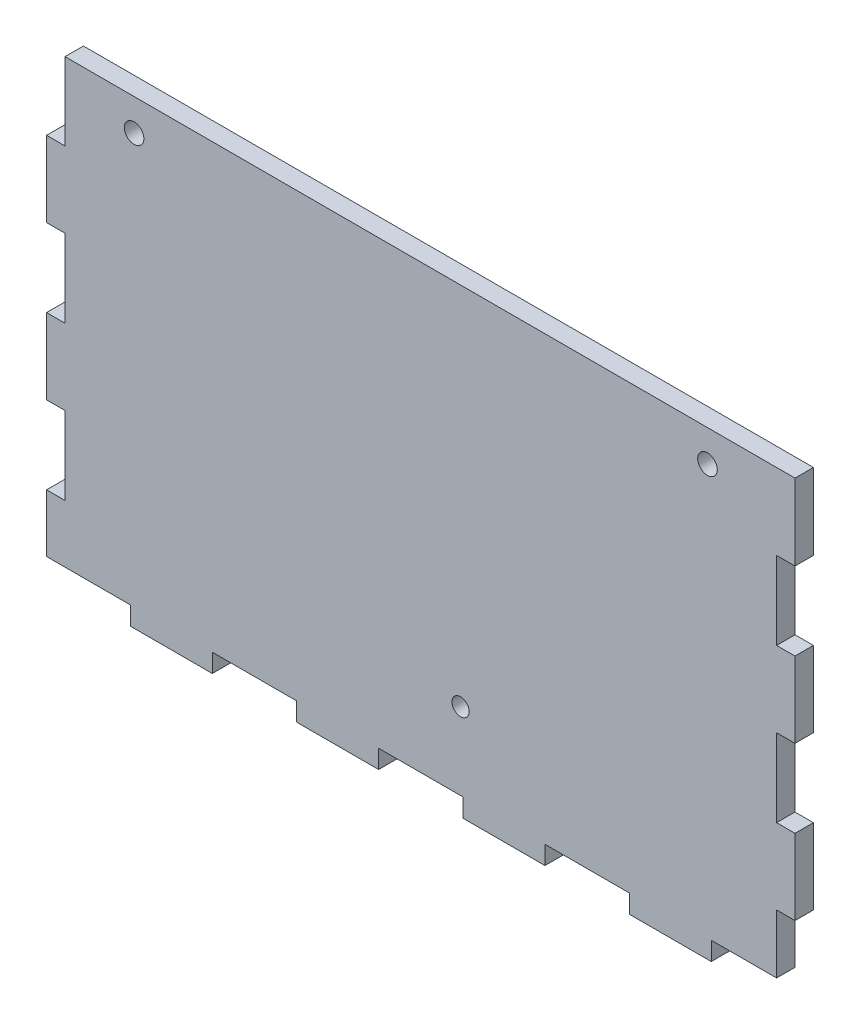
from build123d import *

# Parameters (mm, degrees)
SKETCH1_W           = 130
SKETCH1_H           = 80
BOSS_EXTRUDE1_DEPTH = 3.2
SKETCH2_W           = 14.444444444
SKETCH2_H           = 3.2
SKETCH2_W_2         = 3.2
SKETCH2_H_2         = 13.333333334
SKETCH2_H_3         = 13.333333333
CUT_EXTRUDE1_DEPTH  = 153.676913775
MOVE_FACE1_BY       = 0.1
MOVE_FACE1_2_BY     = 0.1
MOVE_FACE1_3_BY     = 0.1
MOVE_FACE1_4_BY     = 0.1
MOVE_FACE1_5_BY     = 0.1
MOVE_FACE1_6_BY     = 0.1
MOVE_FACE1_7_BY     = 0.1
MOVE_FACE1_8_BY     = 0.1
MOVE_FACE1_9_BY     = 0.1
MOVE_FACE1_10_BY    = 0.1
MOVE_FACE1_11_BY    = 0.1
MOVE_FACE1_12_BY    = 0.1
MOVE_FACE1_13_BY    = 0.1
MOVE_FACE1_14_BY    = 0.1
MOVE_FACE1_15_BY    = 0.1
MOVE_FACE1_16_BY    = 0.1
MOVE_FACE1_17_BY    = 0.1
MOVE_FACE1_18_BY    = 0.1
CUT_EXTRUDE2_REACH  = 154.677
SKETCH3_R           = 1.7
CUT_EXTRUDE3_REACH  = 154.677
SKETCH4_R           = 1.5


with BuildPart() as part:
    # Sketch1 → Boss-Extrude1 (new body)
    with BuildSketch(Plane.XY):
        with Locations((65, 40)):
            Rectangle(SKETCH1_W, SKETCH1_H)
    extrude(amount=BOSS_EXTRUDE1_DEPTH)

    # Sketch2 → Cut-Extrude1 (cut, through all)
    with BuildSketch(Plane.XY.offset(3.2)):
        with Locations((7.222222222, 1.6)):
            Rectangle(SKETCH2_W, SKETCH2_H)
        with Locations((36.111111111, 1.6)):
            Rectangle(SKETCH2_W, SKETCH2_H)
        with Locations((65, 1.6)):
            Rectangle(SKETCH2_W, SKETCH2_H)
        with Locations((93.888888889, 1.6)):
            Rectangle(SKETCH2_W, SKETCH2_H)
        Polygon((115.555555556, 0), (115.555555556, 3.2), (126.8, 3.2), (126.8, 13.333333333), (130, 13.333333333), (130, 0), align=None)
        with Locations((1.6, 20)):
            Rectangle(SKETCH2_W_2, SKETCH2_H_2)
        with Locations((1.6, 46.666666667)):
            Rectangle(SKETCH2_W_2, SKETCH2_H_3)
        with Locations((1.6, 73.333333334)):
            Rectangle(SKETCH2_W_2, SKETCH2_H_3)
        with Locations((128.4, 33.333333334)):
            Rectangle(SKETCH2_W_2, SKETCH2_H_3)
        with Locations((128.4, 60)):
            Rectangle(SKETCH2_W_2, SKETCH2_H_2)
    extrude(amount=-CUT_EXTRUDE1_DEPTH, mode=Mode.SUBTRACT)

    # Move Face1: a face moved inward by 0.1
    extrude(part.faces().sort_by_distance((128.4, 53.333333333, 1.6))[0], amount=MOVE_FACE1_BY, dir=(0, -1, 0), mode=Mode.SUBTRACT)

    # Move Face1 2: a face moved inward by 0.1
    extrude(part.faces().sort_by_distance((128.4, 26.666666667, 1.6))[0], amount=MOVE_FACE1_2_BY, dir=(0, -1, 0), mode=Mode.SUBTRACT)

    # Move Face1 3: a face moved inward by 0.1
    extrude(part.faces().sort_by_distance((128.4, 13.333333333, 1.6))[0], amount=MOVE_FACE1_3_BY, dir=(0, 1, 0), mode=Mode.SUBTRACT)

    # Move Face1 4: a face moved inward by 0.1
    extrude(part.faces().sort_by_distance((128.4, 40, 1.6))[0], amount=MOVE_FACE1_4_BY, dir=(0, 1, 0), mode=Mode.SUBTRACT)

    # Move Face1 5: a face moved inward by 0.1
    extrude(part.faces().sort_by_distance((128.4, 66.666666667, 1.6))[0], amount=MOVE_FACE1_5_BY, dir=(0, 1, 0), mode=Mode.SUBTRACT)

    # Move Face1 6: a face moved inward by 0.1
    extrude(part.faces().sort_by_distance((115.555555556, 1.6, 1.6))[0], amount=MOVE_FACE1_6_BY, dir=(-1, 0, 0), mode=Mode.SUBTRACT)

    # Move Face1 7: a face moved inward by 0.1
    extrude(part.faces().sort_by_distance((86.666666667, 1.6, 1.6))[0], amount=MOVE_FACE1_7_BY, dir=(-1, 0, 0), mode=Mode.SUBTRACT)

    # Move Face1 8: a face moved inward by 0.1
    extrude(part.faces().sort_by_distance((57.777777778, 1.6, 1.6))[0], amount=MOVE_FACE1_8_BY, dir=(-1, 0, 0), mode=Mode.SUBTRACT)

    # Move Face1 9: a face moved inward by 0.1
    extrude(part.faces().sort_by_distance((28.888888889, 1.6, 1.6))[0], amount=MOVE_FACE1_9_BY, dir=(-1, 0, 0), mode=Mode.SUBTRACT)

    # Move Face1 10: a face moved inward by 0.1
    extrude(part.faces().sort_by_distance((14.444444444, 1.6, 1.6))[0], amount=MOVE_FACE1_10_BY, dir=(1, 0, 0), mode=Mode.SUBTRACT)

    # Move Face1 11: a face moved inward by 0.1
    extrude(part.faces().sort_by_distance((43.333333333, 1.6, 1.6))[0], amount=MOVE_FACE1_11_BY, dir=(1, 0, 0), mode=Mode.SUBTRACT)

    # Move Face1 12: a face moved inward by 0.1
    extrude(part.faces().sort_by_distance((72.222222222, 1.6, 1.6))[0], amount=MOVE_FACE1_12_BY, dir=(1, 0, 0), mode=Mode.SUBTRACT)

    # Move Face1 13: a face moved inward by 0.1
    extrude(part.faces().sort_by_distance((101.111111111, 1.6, 1.6))[0], amount=MOVE_FACE1_13_BY, dir=(1, 0, 0), mode=Mode.SUBTRACT)

    # Move Face1 14: a face moved inward by 0.1
    extrude(part.faces().sort_by_distance((1.6, 26.666666667, 1.6))[0], amount=MOVE_FACE1_14_BY, dir=(0, 1, 0), mode=Mode.SUBTRACT)

    # Move Face1 15: a face moved inward by 0.1
    extrude(part.faces().sort_by_distance((1.6, 13.333333333, 1.6))[0], amount=MOVE_FACE1_15_BY, dir=(0, -1, 0), mode=Mode.SUBTRACT)

    # Move Face1 16: a face moved inward by 0.1
    extrude(part.faces().sort_by_distance((1.6, 40, 1.6))[0], amount=MOVE_FACE1_16_BY, dir=(0, -1, 0), mode=Mode.SUBTRACT)

    # Move Face1 17: a face moved inward by 0.1
    extrude(part.faces().sort_by_distance((1.6, 53.333333333, 1.6))[0], amount=MOVE_FACE1_17_BY, dir=(0, 1, 0), mode=Mode.SUBTRACT)

    # Move Face1 18: a face moved inward by 0.1
    extrude(part.faces().sort_by_distance((1.6, 66.666666667, 1.6))[0], amount=MOVE_FACE1_18_BY, dir=(0, -1, 0), mode=Mode.SUBTRACT)

    # Sketch3 → Cut-Extrude2 (cut, up to next)
    with BuildSketch(Plane.XY.offset(3.2), mode=Mode.PRIVATE) as cut_extrude2_sk1:
        with Locations((15.2, 74.5)):
            Circle(SKETCH3_R)
    cut_extrude2_tool1 = extrude(cut_extrude2_sk1.sketch, amount=-CUT_EXTRUDE2_REACH, mode=Mode.PRIVATE) & part.part
    # Sketch3 → Cut-Extrude2 (cut, up to next)
    with BuildSketch(Plane.XY.offset(3.2), mode=Mode.PRIVATE) as cut_extrude2_sk2:
        with Locations((114.8, 74.5)):
            Circle(SKETCH3_R)
    cut_extrude2_tool2 = extrude(cut_extrude2_sk2.sketch, amount=-CUT_EXTRUDE2_REACH, mode=Mode.PRIVATE) & part.part
    add(cut_extrude2_tool1.solids().sort_by_distance((15.2, 74.5, 3.2))[0], mode=Mode.SUBTRACT)
    add(cut_extrude2_tool2.solids().sort_by_distance((114.8, 74.5, 3.2))[0], mode=Mode.SUBTRACT)

    # Sketch4 → Cut-Extrude3 (cut, up to next)
    with BuildSketch(Plane(origin=(0, 0, 0), x_dir=(-1, 0, 0), z_dir=(0, 0, -1)), mode=Mode.PRIVATE) as cut_extrude3_sk1:
        with Locations((-71.91, 16.56)):
            Circle(SKETCH4_R)
    cut_extrude3_tool1 = extrude(cut_extrude3_sk1.sketch, amount=-CUT_EXTRUDE3_REACH, mode=Mode.PRIVATE) & part.part
    add(cut_extrude3_tool1.solids().sort_by_distance((71.91, 16.56, 0))[0], mode=Mode.SUBTRACT)


solid = part.part
